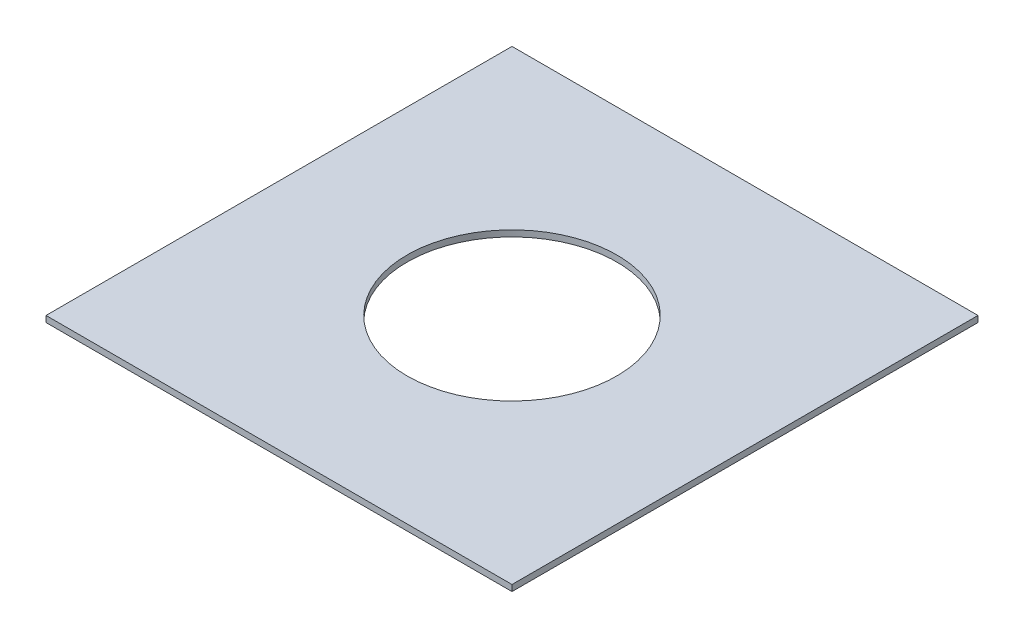
from build123d import *

# Parameters (mm, degrees)
SKETCH1_W           = 60
SKETCH1_H           = 60
SKETCH1_R           = 13.5
BOSS_EXTRUDE1_DEPTH = 0.79375


with BuildPart() as part:
    # Sketch1 → Boss-Extrude1 (new body)
    with BuildSketch(Plane(origin=(0, 0, 0), x_dir=(1, 0, 0), z_dir=(0, 1, 0))):
        with Locations((47.557337307, -13.550075225)):
            Rectangle(SKETCH1_W, SKETCH1_H)
        with Locations((47.557337307, -13.550075225)):
            Circle(SKETCH1_R, mode=Mode.SUBTRACT)
    extrude(amount=BOSS_EXTRUDE1_DEPTH)


solid = part.part
